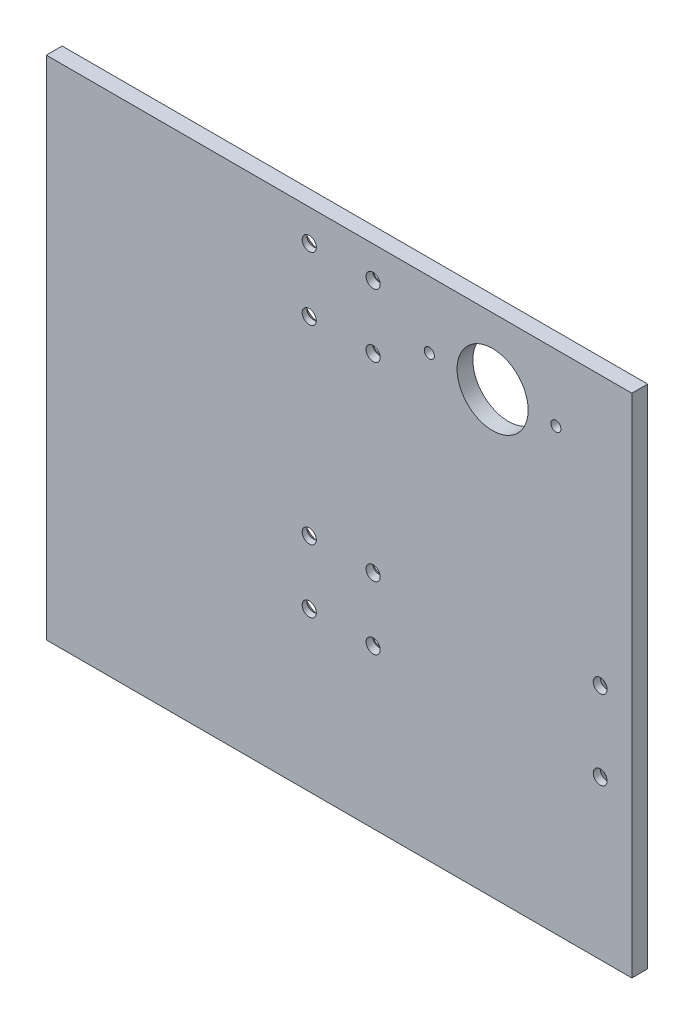
from build123d import *

# Parameters (mm, degrees)
SKETCH1_W                                          = 234.95
SKETCH1_H                                          = 203.2
BOSS_EXTRUDE1_DEPTH                                = 6.35
SKETCH2_R                                          = 14.2748
CUT_EXTRUDE1_DEPTH                                 = 156.445354144
CSK_FOR_10_FLAT_HEAD_MACHINE_SCREW_100_D           = 5.6134
CSK_FOR_10_FLAT_HEAD_MACHINE_SCREW_100_CSINK_D     = 17.78
CSK_FOR_10_FLAT_HEAD_MACHINE_SCREW_100_CSINK_ANGLE = 90
CSK_FOR_10_FLAT_HEAD_MACHINE_SCREW_2_D             = 5.6134
CSK_FOR_10_FLAT_HEAD_MACHINE_SCREW_2_CSINK_D       = 17.78
CSK_FOR_10_FLAT_HEAD_MACHINE_SCREW_2_CSINK_ANGLE   = 90
CSK_FOR_10_FLAT_HEAD_MACHINE_SCREW_3_D             = 5.6134
CSK_FOR_10_FLAT_HEAD_MACHINE_SCREW_3_DEPTH         = 23.972796233
CSK_FOR_10_FLAT_HEAD_MACHINE_SCREW_3_CSINK_D       = 12.7
CSK_FOR_10_FLAT_HEAD_MACHINE_SCREW_3_CSINK_ANGLE   = 90
CSK_FOR_10_FLAT_HEAD_MACHINE_SCREW_3_TIP           = 1.686435499
CUT_EXTRUDE2_DEPTH                                 = 156.445354144


with BuildPart() as part:
    # Sketch1 → Boss-Extrude1 (new body)
    with BuildSketch(Plane.XY):
        Rectangle(SKETCH1_W, SKETCH1_H)
    extrude(amount=BOSS_EXTRUDE1_DEPTH)

    # Sketch2 → Cut-Extrude1 (cut, through all)
    with BuildSketch(Plane.XY.offset(6.35)):
        with Locations((61.595, 74.93)):
            Circle(SKETCH2_R)
    extrude(amount=-CUT_EXTRUDE1_DEPTH, mode=Mode.SUBTRACT)

    # CSK for _10 Flat Head Machine Screw _100 (through all)
    with Locations(Plane(origin=(292.076985897, -265.595089466, -43.80037576), x_dir=(0.9908610866457157, 0, -0.1348862742137668), z_dir=(-0.1348862742137668, 0, -0.9908610866457157))):
        with Locations((-308.041854918, -227.495089466), (-308.041854918, -252.895089466), (-308.041972913, -329.095089466), (-308.041972913, -354.495089466)):
            CounterSinkHole(CSK_FOR_10_FLAT_HEAD_MACHINE_SCREW_100_D / 2, CSK_FOR_10_FLAT_HEAD_MACHINE_SCREW_100_CSINK_D / 2, counter_sink_angle=CSK_FOR_10_FLAT_HEAD_MACHINE_SCREW_100_CSINK_ANGLE)

    # CSK for _10 Flat Head Machine Screw  2 (through all)
    with Locations(Plane(origin=(292.419597033, -265.595089466, -41.283588599), x_dir=(0.9908610866457157, 0, -0.13488627421376656), z_dir=(-0.13488627421376656, 0, -0.9908610866457157))):
        with Locations((-282.641854918, -227.495089466), (-282.641854918, -252.895089466), (-282.641972913, -329.095089466), (-282.641972913, -354.495089466)):
            CounterSinkHole(CSK_FOR_10_FLAT_HEAD_MACHINE_SCREW_2_D / 2, CSK_FOR_10_FLAT_HEAD_MACHINE_SCREW_2_CSINK_D / 2, counter_sink_angle=CSK_FOR_10_FLAT_HEAD_MACHINE_SCREW_2_CSINK_ANGLE)

    # CSK for _10 Flat Head Machine Screw  3
    with Locations(Plane(origin=(-285.488101876, 60.95524491, 0), x_dir=(-1, 0, 0), z_dir=(0, 0, -1))):
        with Locations((-390.263101876, -67.30524491), (-390.263101876, -99.05524491)):
            CounterSinkHole(CSK_FOR_10_FLAT_HEAD_MACHINE_SCREW_3_D / 2, CSK_FOR_10_FLAT_HEAD_MACHINE_SCREW_3_CSINK_D / 2, depth=CSK_FOR_10_FLAT_HEAD_MACHINE_SCREW_3_DEPTH, counter_sink_angle=CSK_FOR_10_FLAT_HEAD_MACHINE_SCREW_3_CSINK_ANGLE)
            with Locations((0, 0, -(CSK_FOR_10_FLAT_HEAD_MACHINE_SCREW_3_DEPTH + CSK_FOR_10_FLAT_HEAD_MACHINE_SCREW_3_TIP / 2))):  # 118° drill point
                Cone(0, CSK_FOR_10_FLAT_HEAD_MACHINE_SCREW_3_D / 2, CSK_FOR_10_FLAT_HEAD_MACHINE_SCREW_3_TIP, mode=Mode.SUBTRACT)

    # Sketch10 → Cut-Extrude2 (cut, through all)
    with BuildSketch(Plane(origin=(0, 0, 0), x_dir=(-1, 0, 0), z_dir=(0, 0, -1))):
        with BuildLine():
            ThreePointArc((-86.995, 76.9493), (-89.0143, 74.93), (-86.995, 72.9107))
            ThreePointArc((-86.995, 72.9107), (-84.9757, 74.93), (-86.995, 76.9493))
        make_face()
        with BuildLine():
            ThreePointArc((-36.195, 76.9493), (-38.2143, 74.93), (-36.195, 72.9107))
            ThreePointArc((-36.195, 72.9107), (-34.1757, 74.93), (-36.195, 76.9493))
        make_face()
    extrude(amount=-CUT_EXTRUDE2_DEPTH, mode=Mode.SUBTRACT)


solid = part.part
